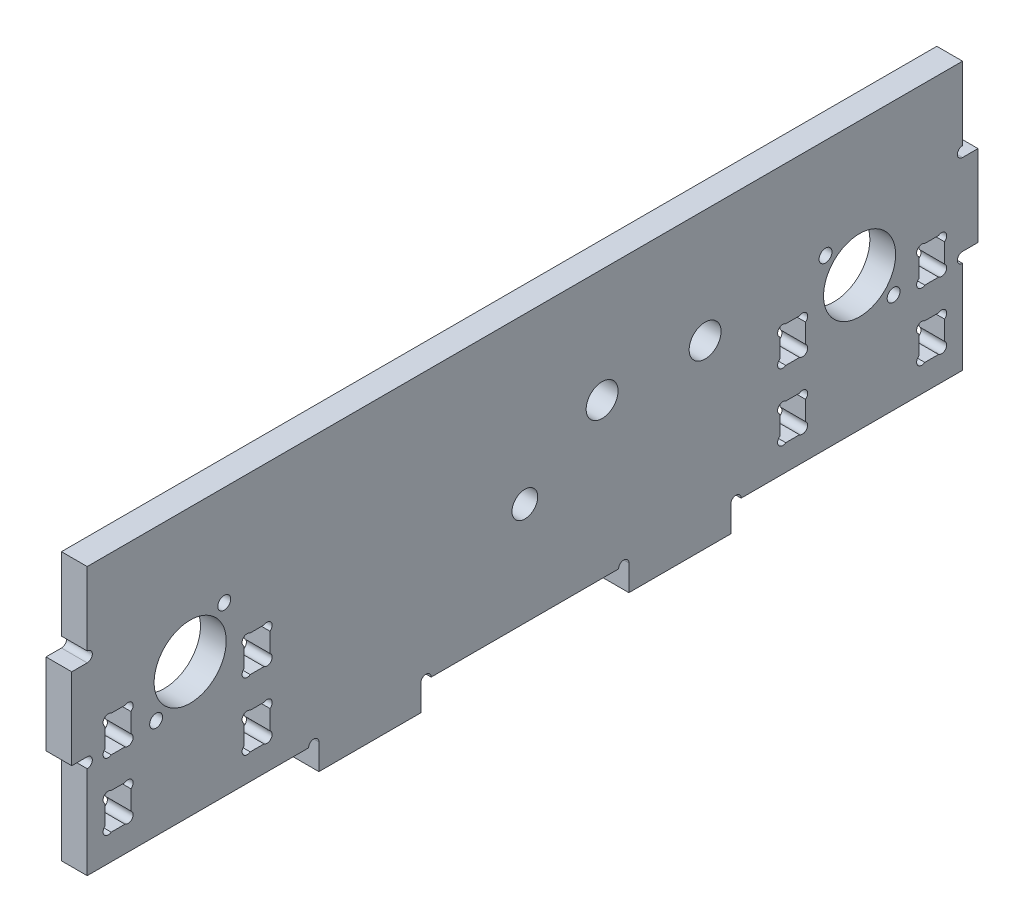
from build123d import *

# Parameters (mm, degrees)
SKETCH_1_W          = 170
SKETCH_1_H          = 52
EXTRUDE_1_DEPTH     = 5
SKETCH_2_R          = 7
CUT_EXTRUDE_1_DEPTH = 10
SKETCH_3_W          = 19.8
SKETCH_3_H          = 5
EXTRUDE_2_DEPTH     = 5
SKETCH_8_W          = 3
SKETCH_8_H          = 15.8
EXTRUDE_3_DEPTH     = 5
SKETCH_7_R          = 1
CUT_EXTRUDE_3_DEPTH = 10
SKETCH_10_W         = 5
SKETCH_10_H         = 7
CUT_EXTRUDE_4_DEPTH = 10
SKETCH_11_R         = 1.000000001
SKETCH_11_R_2       = 0.999999999
CUT_EXTRUDE_5_DEPTH = 10
SKETCH_13_R         = 3.1
SKETCH_13_R_2       = 2.5
CUT_EXTRUDE_7_DEPTH = 10
SKETCH_14_R         = 1.25
CUT_EXTRUDE_8_DEPTH = 10


with BuildPart() as part:
    # 스케치1 → 보스-돌출1 (new body)
    with BuildSketch(Plane(origin=(0, 0, 0), x_dir=(0, 0, -1), z_dir=(1, 0, 0))):
        with Locations((85, 26)):
            Rectangle(SKETCH_1_W, SKETCH_1_H)
    extrude(amount=EXTRUDE_1_DEPTH)

    # 스케치2 → 컷-돌출1 (cut)
    with BuildSketch(Plane(origin=(5, 0, 0), x_dir=(0, 0, -1), z_dir=(1, 0, 0))):
        with Locations((150, 26)):
            Circle(SKETCH_2_R)
        with Locations((20, 26)):
            Circle(SKETCH_2_R)
    extrude(amount=-CUT_EXTRUDE_1_DEPTH, mode=Mode.SUBTRACT)

    # 스케치3 → 보스-돌출2 (add)
    with BuildSketch(Plane(origin=(5, 0, 0), x_dir=(0, 0, -1), z_dir=(1, 0, 0))):
        with Locations((54.9, -2.5)):
            Rectangle(SKETCH_3_W, SKETCH_3_H)
        with Locations((115.1, -2.5)):
            Rectangle(SKETCH_3_W, SKETCH_3_H)
    extrude(amount=-EXTRUDE_2_DEPTH)

    # 스케치8 → 보스-돌출3 (add)
    with BuildSketch(Plane(origin=(5, 0, 0), x_dir=(0, 0, -1), z_dir=(1, 0, 0))):
        with Locations((171.5, 27.9)):
            Rectangle(SKETCH_8_W, SKETCH_8_H)
        with Locations((-1.5, 27.9)):
            Rectangle(SKETCH_8_W, SKETCH_8_H)
    extrude(amount=-EXTRUDE_3_DEPTH)

    # 스케치7 → 컷-돌출3 (cut)
    with BuildSketch(Plane(origin=(5, 0, 0), x_dir=(0, 0, -1), z_dir=(1, 0, 0))):
        with Locations((65.8, 0)):
            Circle(SKETCH_7_R)
        with Locations((44, 0)):
            Circle(SKETCH_7_R)
        with Locations((104.2, 0)):
            Circle(SKETCH_7_R)
        with Locations((126, 0)):
            Circle(SKETCH_7_R)
        with Locations((170, 36.8)):
            Circle(SKETCH_7_R)
        with Locations((170, 19)):
            Circle(SKETCH_7_R)
        with Locations((0, 36.8)):
            Circle(SKETCH_7_R)
        with Locations((0, 19)):
            Circle(SKETCH_7_R)
    extrude(amount=-CUT_EXTRUDE_3_DEPTH, mode=Mode.SUBTRACT)

    # 스케치10 → 컷-돌출4 (cut)
    with BuildSketch(Plane.ZY):
        with Locations((-163.999999999, 21.5)):
            Rectangle(SKETCH_10_W, SKETCH_10_H)
        with Locations((-136.999999999, 21.5)):
            Rectangle(SKETCH_10_W, SKETCH_10_H)
        with Locations((-163.999999999, 8.5)):
            Rectangle(SKETCH_10_W, SKETCH_10_H)
        with Locations((-136.999999999, 8.5)):
            Rectangle(SKETCH_10_W, SKETCH_10_H)
        with Locations((-33.000000001, 8.5)):
            Rectangle(SKETCH_10_W, SKETCH_10_H)
        with Locations((-6.000000001, 8.5)):
            Rectangle(SKETCH_10_W, SKETCH_10_H)
        with Locations((-33.000000001, 21.5)):
            Rectangle(SKETCH_10_W, SKETCH_10_H)
        with Locations((-6.000000001, 21.5)):
            Rectangle(SKETCH_10_W, SKETCH_10_H)
    extrude(amount=-CUT_EXTRUDE_4_DEPTH, mode=Mode.SUBTRACT)

    # 스케치11 → 컷-돌출5 (cut)
    with BuildSketch(Plane(origin=(5, 0, 0), x_dir=(0, 0, -1), z_dir=(1, 0, 0))):
        with Locations((165.918761805, 24.186266529)):
            Circle(SKETCH_11_R)
        with Locations((162.081238192, 24.186266529)):
            Circle(SKETCH_11_R)
        with Locations((165.918761805, 18.813733471)):
            Circle(SKETCH_11_R)
        with Locations((162.081238192, 18.813733471)):
            Circle(SKETCH_11_R)
        with Locations((138.918761805, 18.813733471)):
            Circle(SKETCH_11_R_2)
        with Locations((135.081238192, 18.813733471)):
            Circle(SKETCH_11_R_2)
        with Locations((138.918761805, 24.186266529)):
            Circle(SKETCH_11_R_2)
        with Locations((135.081238192, 24.186266529)):
            Circle(SKETCH_11_R_2)
        with Locations((135.081238192, 5.813733471)):
            Circle(SKETCH_11_R_2)
        with Locations((138.918761805, 5.813733471)):
            Circle(SKETCH_11_R_2)
        with Locations((135.081238192, 11.186266529)):
            Circle(SKETCH_11_R_2)
        with Locations((138.918761805, 11.186266529)):
            Circle(SKETCH_11_R_2)
        with Locations((162.081238192, 11.186266529)):
            Circle(SKETCH_11_R)
        with Locations((165.918761805, 11.186266529)):
            Circle(SKETCH_11_R)
        with Locations((162.081238192, 5.813733471)):
            Circle(SKETCH_11_R)
        with Locations((165.918761805, 5.813733471)):
            Circle(SKETCH_11_R)
        with Locations((4.081238195, 5.813733471)):
            Circle(SKETCH_11_R)
        with Locations((7.918761808, 5.813733471)):
            Circle(SKETCH_11_R)
        with Locations((4.081238195, 11.186266529)):
            Circle(SKETCH_11_R)
        with Locations((7.918761808, 11.186266529)):
            Circle(SKETCH_11_R)
        with Locations((31.081238195, 11.186266529)):
            Circle(SKETCH_11_R_2)
        with Locations((34.918761808, 11.186266529)):
            Circle(SKETCH_11_R_2)
        with Locations((31.081238195, 5.813733471)):
            Circle(SKETCH_11_R_2)
        with Locations((34.918761808, 5.813733471)):
            Circle(SKETCH_11_R_2)
        with Locations((34.918761808, 24.186266529)):
            Circle(SKETCH_11_R_2)
        with Locations((31.081238195, 24.186266529)):
            Circle(SKETCH_11_R_2)
        with Locations((34.918761808, 18.813733471)):
            Circle(SKETCH_11_R_2)
        with Locations((31.081238195, 18.813733471)):
            Circle(SKETCH_11_R_2)
        with Locations((7.918761808, 18.813733471)):
            Circle(SKETCH_11_R)
        with Locations((4.081238195, 18.813733471)):
            Circle(SKETCH_11_R)
        with Locations((7.918761808, 24.186266529)):
            Circle(SKETCH_11_R)
        with Locations((4.081238195, 24.186266529)):
            Circle(SKETCH_11_R)
    extrude(amount=-CUT_EXTRUDE_5_DEPTH, mode=Mode.SUBTRACT)

    # 스케치13 → 컷-돌출7 (cut)
    with BuildSketch(Plane(origin=(5, 0, 0), x_dir=(0, 0, -1), z_dir=(1, 0, 0))):
        with Locations((100, 30)):
            Circle(SKETCH_13_R)
        with Locations((120, 30)):
            Circle(SKETCH_13_R)
        with Locations((85, 20)):
            Circle(SKETCH_13_R_2)
    extrude(amount=-CUT_EXTRUDE_7_DEPTH, mode=Mode.SUBTRACT)

    # 스케치14 → 컷-돌출8 (cut)
    with BuildSketch(Plane(origin=(5, 0, 0), x_dir=(0, 0, -1), z_dir=(1, 0, 0))):
        with Locations((156.611448404, 19.388551596)):
            Circle(SKETCH_14_R)
        with Locations((143.388551596, 32.611448404)):
            Circle(SKETCH_14_R)
        with Locations((13.388551596, 19.388551596)):
            Circle(SKETCH_14_R)
        with Locations((26.611448404, 32.611448404)):
            Circle(SKETCH_14_R)
    extrude(amount=-CUT_EXTRUDE_8_DEPTH, mode=Mode.SUBTRACT)


solid = part.part
